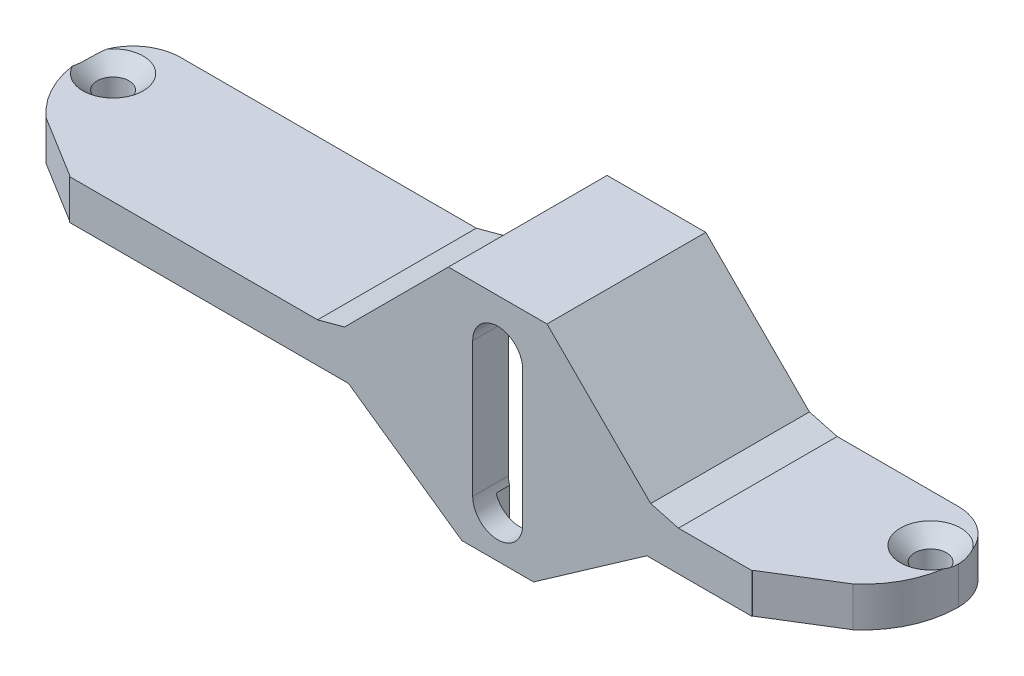
from build123d import *

# Parameters (mm, degrees)
BOSS_EXTRUDE1_DEPTH           = 3
CUT_EXTRUDE1_DEPTH            = 10
CUT_EXTRUDE3_START            = 8
SKETCH8_W                     = 6
SKETCH8_H                     = 3
CUT_EXTRUDE3_DEPTH            = 6
BOSS_EXTRUDE4_START           = 18
BOSS_EXTRUDE4_DEPTH           = 28
BOSS_EXTRUDE5_DEPTH           = 3
CUT_EXTRUDE4_DEPTH            = 3
CUT_EXTRUDE5_DEPTH            = 10
SKETCH18_R                    = 1.5
BOSS_EXTRUDE9_DEPTH           = 2
CHAMFER1_SIZE                 = 15
CHAMFER2_SIZE                 = 15
CHAMFER2_SIZE_2               = 10.503113073
CUT_EXTRUDE6_DEPTH            = 5
BOSS_EXTRUDE8_DEPTH           = 2
CHAMFER3_DEPTH                = 6
CHAMFER3_2_DEPTH              = 5
CSK_FOR_M4_SFHCS1_D           = 4
CSK_FOR_M4_SFHCS1_DEPTH       = 30.798278762
CSK_FOR_M4_SFHCS1_CSINK_D     = 7.6
CSK_FOR_M4_SFHCS1_CSINK_ANGLE = 90
CSK_FOR_M4_SFHCS1_TIP         = 1.201721238
CUT_EXTRUDE7_DEPTH            = 1.5
BOSS_EXTRUDE10_START          = -6
BOSS_EXTRUDE10_DEPTH          = 20
CHAMFER4_SIZE                 = 1.07179677
CHAMFER4_SIZE_2               = 4


with BuildPart() as part:
    # Sketch1 → Boss-Extrude1 (new body)
    with BuildSketch(Plane(origin=(0, 0, 0), x_dir=(1, 0, 0), z_dir=(0, 1, 0))):
        with BuildLine():
            ThreePointArc((-49, -6), (-53.242640687, -4.242640687), (-55, 0))
            ThreePointArc((-55, 0), (-51.485281374, -8.485281374), (-43, -12))
            Line((-43, -12), (43, -12))
            ThreePointArc((43, -12), (51.485281374, -8.485281374), (55, 0))
            ThreePointArc((55, 0), (53.242640687, -4.242640687), (49, -6))
            Line((49, -6), (-49, -6))
        make_face()
        with BuildLine():
            Line((-53, 0), (-55, 0))
            ThreePointArc((-55, 0), (-53.242640687, -4.242640687), (-49, -6))
            Line((-49, -6), (49, -6))
            ThreePointArc((49, -6), (53.242640687, -4.242640687), (55, 0))
            Line((55, 0), (53, 0))
            ThreePointArc((53, 0), (51.5, -1.5), (50, 0))
            Line((50, 0), (-50, 0))
            ThreePointArc((-50, 0), (-51.5, -1.5), (-53, 0))
        make_face()
        with BuildLine():
            Line((49, 6), (-49, 6))
            ThreePointArc((-49, 6), (-53.242640687, 4.242640687), (-55, 0))
            Line((-55, 0), (-53, 0))
            ThreePointArc((-53, 0), (-51.5, 1.5), (-50, 0))
            Line((-50, 0), (50, 0))
            ThreePointArc((50, 0), (51.5, 1.5), (53, 0))
            Line((53, 0), (55, 0))
            ThreePointArc((55, 0), (53.242640687, 4.242640687), (49, 6))
        make_face()
    extrude(amount=BOSS_EXTRUDE1_DEPTH)

    # Sketch2 → Cut-Extrude1 (cut)
    with BuildSketch(Plane(origin=(0, 3, 0), x_dir=(1, 0, 0), z_dir=(0, 1, 0))):
        Polygon((22, -8), (36, 6), (-14, 6), (0, -8), align=None)
    extrude(amount=-CUT_EXTRUDE1_DEPTH, mode=Mode.SUBTRACT)

    # Sketch8 → Cut-Extrude3 (cut)
    with BuildSketch(Plane.XY.offset(CUT_EXTRUDE3_START)):
        with Locations((10.960071178, 1.5)):
            Rectangle(SKETCH8_W, SKETCH8_H)
    extrude(amount=CUT_EXTRUDE3_DEPTH, mode=Mode.SUBTRACT)


with BuildPart() as cut_extrude3_piece_1:
    # of the separate pieces the step leaves, piece 1, a body of its own (cut_extrude3_pieces)
    add(part.part.solids().sort_by_distance((-55, 0, 0))[0])

    # Sketch9 → Boss-Extrude4 (add)
    with BuildSketch(Plane(origin=(0, 0, 0), x_dir=(1, 0, 0), z_dir=(0, 1, 0)).offset(BOSS_EXTRUDE4_START)):
        Polygon((13.960071178, -11.2), (13.960071178, -8), (14.760071178, -8), (14.760071178, -12), (7.160071178, -12), (7.160071178, -8), (7.960071178, -8), (7.960071178, -11.2), align=None)
    extrude(amount=-BOSS_EXTRUDE4_DEPTH)


with BuildPart() as cut_extrude3_piece_2:
    # of the separate pieces the step leaves, piece 2, a body of its own (cut_extrude3_pieces)
    add(part.part.solids().sort_by_distance((13.960071178, 0, 12))[0])


with BuildPart() as cut_extrude3_piece_1_1:
    add(cut_extrude3_piece_1.part)

    # Combine1: union Cut-Extrude3 piece 2
    add(cut_extrude3_piece_2.part)

    # Sketch11 → Boss-Extrude5 (add)
    with BuildSketch(Plane(origin=(0, 3, 0), x_dir=(1, 0, 0), z_dir=(0, 1, 0))):
        Polygon((-14, 6), (-12, 6), (2, -8), (0, -8), align=None)
        Polygon((20, -8), (34, 6), (36, 6), (22, -8), align=None)
    extrude(amount=-BOSS_EXTRUDE5_DEPTH)

    # Sketch13 → Cut-Extrude4 (cut)
    with BuildSketch(Plane(origin=(0, 3, 0), x_dir=(1, 0, 0), z_dir=(0, 1, 0))):
        Polygon((2, -8), (-2, -8), (-2, -4), align=None)
        Polygon((24, -4), (24, -8), (20, -8), align=None)
    extrude(amount=-CUT_EXTRUDE4_DEPTH, mode=Mode.SUBTRACT)

    # Sketch15 → Cut-Extrude5 (cut)
    with BuildSketch(Plane.XY.offset(12)):
        with BuildLine():
            Line((14.110071178, 12.5), (14.110071178, -4.5))
            ThreePointArc((14.110071178, -4.5), (10.960071178, -7.65), (7.810071178, -4.5))
            Line((7.810071178, -4.5), (7.810071178, 12.5))
            ThreePointArc((7.810071178, 12.5), (10.960071178, 15.65), (14.110071178, 12.5))
        make_face()
    extrude(amount=-CUT_EXTRUDE5_DEPTH, mode=Mode.SUBTRACT)

    # Sketch18 → Boss-Extrude9 (add)
    # profile 1 of 2: a face of its own
    with BuildSketch(Plane(origin=(0, 3, 0), x_dir=(1, 0, 0), z_dir=(0, 1, 0))):
        with BuildLine():
            Line((7.160071178, -8), (-2, -8))
            Line((-2, -8), (-2, -4))
            Line((-2, -4), (-12, 6))
            Line((-12, 6), (-49, 6))
            ThreePointArc((-49, 6), (-53.242640687, 4.242640687), (-55, 0))
            ThreePointArc((-55, 0), (-51.485281374, -8.485281374), (-43, -12))
            Line((-43, -12), (7.160071178, -12))
            Line((7.160071178, -12), (7.160071178, -8))
        make_face()
        with Locations(Location((-51.5, 0, 0), (0, 0, 270))):
            Circle(SKETCH18_R, mode=Mode.SUBTRACT)
    # profile 2 of 2: a face of its own
    with BuildSketch(Plane(origin=(0, 3, 0), x_dir=(1, 0, 0), z_dir=(0, 1, 0))):
        with BuildLine():
            Line((24, -4), (24, -8))
            Line((24, -8), (14.760071178, -8))
            Line((14.760071178, -8), (14.760071178, -12))
            Line((14.760071178, -12), (43, -12))
            ThreePointArc((43, -12), (51.485281374, -8.485281374), (55, 0))
            ThreePointArc((55, 0), (53.242640687, 4.242640687), (49, 6))
            Line((49, 6), (34, 6))
            Line((34, 6), (24, -4))
        make_face()
        with Locations(Location((51.5, 0, 0), (0, 0, 270))):
            Circle(SKETCH18_R, mode=Mode.SUBTRACT)
    extrude(amount=BOSS_EXTRUDE9_DEPTH)

    # Chamfer1
    # the kernel refuses this chamfer: 15 mm, written as the material it adds along each edge
    with BuildSketch(Plane(origin=(14.760071178, 5, 8), x_dir=(0, 1, 0), z_dir=(0, 0, 1))) as chamfer1_piece_1_section:
        Polygon((CHAMFER1_SIZE, 0), (0, -CHAMFER1_SIZE), (0, 0), align=None)
    chamfer1_piece_1 = extrude(amount=4, mode=Mode.PRIVATE)
    chamfer1_piece_1 = split(chamfer1_piece_1, bisect_by=Plane(origin=(14.760071178, 18, 8), z_dir=(0, -1, 0)), keep=Keep.TOP, mode=Mode.PRIVATE)
    chamfer1_piece_1 = split(chamfer1_piece_1, bisect_by=Plane(origin=(17.380035589, 5, 10.619964411), z_dir=(-0.7071067811865474, 0, -0.7071067811865477)), keep=Keep.TOP, mode=Mode.PRIVATE)
    add(chamfer1_piece_1)
    with BuildSketch(Plane(origin=(14.760071178, 5, -30.575244819), x_dir=(0, 1, 0), z_dir=(0, 0, 1))) as chamfer1_piece_2_section:
        Polygon((CHAMFER1_SIZE, 0), (0, -CHAMFER1_SIZE), (0, 0), align=None)
    chamfer1_piece_2 = extrude(amount=42.575244819, mode=Mode.PRIVATE)
    chamfer1_piece_2 = split(chamfer1_piece_2, bisect_by=Plane(origin=(14.760071178, 5, 8), z_dir=(0, 0, -1)), keep=Keep.TOP, mode=Mode.PRIVATE)
    chamfer1_piece_2 = split(chamfer1_piece_2, bisect_by=Plane(origin=(36.667657999, 5, -8.667657999), z_dir=(0.7071067811865474, 0, 0.7071067811865477)), keep=Keep.TOP, mode=Mode.PRIVATE)
    chamfer1_piece_2 = split(chamfer1_piece_2, bisect_by=Plane(origin=(24, 5, -30.575244819), z_dir=(1, 0, 0)), keep=Keep.TOP, mode=Mode.PRIVATE)
    add(chamfer1_piece_2)
    with BuildSketch(Plane(origin=(14.760071178, 5, 8), x_dir=(0, 1, 0), z_dir=(0, 0, 1))) as chamfer1_piece_3_section:
        Polygon((CHAMFER1_SIZE, 0), (0, -CHAMFER1_SIZE), (0, 0), align=None)
    chamfer1_piece_3 = extrude(amount=4, mode=Mode.PRIVATE)
    chamfer1_piece_3 = split(chamfer1_piece_3, bisect_by=Plane(origin=(14.760071178, 18, 8), z_dir=(0, -1, 0)), keep=Keep.TOP, mode=Mode.PRIVATE)
    chamfer1_piece_3 = split(chamfer1_piece_3, bisect_by=Plane(origin=(17.380035589, 5, 10.619964411), z_dir=(0.7071067811865474, 0, 0.7071067811865477)), keep=Keep.TOP, mode=Mode.PRIVATE)
    chamfer1_piece_3 = split(chamfer1_piece_3, bisect_by=Plane(origin=(24, 5, 8), z_dir=(-1, 0, 0)), keep=Keep.TOP, mode=Mode.PRIVATE)
    add(chamfer1_piece_3)
    with BuildSketch(Plane(origin=(14.760071178, 5, 8), x_dir=(0, 1, 0), z_dir=(0, 0, 1))) as chamfer1_piece_4_section:
        Polygon((CHAMFER1_SIZE, 0), (0, -CHAMFER1_SIZE), (0, 0), align=None)
    chamfer1_piece_4 = extrude(amount=4, mode=Mode.PRIVATE)
    chamfer1_piece_4 = split(chamfer1_piece_4, bisect_by=Plane(origin=(24, 5, 8), z_dir=(1, 0, 0)), keep=Keep.TOP, mode=Mode.PRIVATE)
    add(chamfer1_piece_4)
    with BuildSketch(Plane(origin=(7.160071178, 5, 12), x_dir=(0, 1, 0), z_dir=(0, 0, -1))) as chamfer1_piece_5_section:
        Polygon((CHAMFER1_SIZE, 0), (0, -CHAMFER1_SIZE), (0, 0), align=None)
    chamfer1_piece_5 = extrude(amount=4, mode=Mode.PRIVATE)
    chamfer1_piece_5 = split(chamfer1_piece_5, bisect_by=Plane(origin=(6.580035589, 5, 12.580035589), z_dir=(-0.7071067811865489, 0, 0.7071067811865461)), keep=Keep.TOP, mode=Mode.PRIVATE)
    chamfer1_piece_5 = split(chamfer1_piece_5, bisect_by=Plane(origin=(-2, 5, 12), z_dir=(1, 0, 0)), keep=Keep.TOP, mode=Mode.PRIVATE)
    chamfer1_piece_5 = split(chamfer1_piece_5, bisect_by=Plane(origin=(7.160071178, 18, 12), z_dir=(0, -1, 0)), keep=Keep.TOP, mode=Mode.PRIVATE)
    add(chamfer1_piece_5)
    with BuildSketch(Plane(origin=(7.160071178, 5, 12), x_dir=(0, 1, 0), z_dir=(0, 0, -1))) as chamfer1_piece_6_section:
        Polygon((CHAMFER1_SIZE, 0), (0, -CHAMFER1_SIZE), (0, 0), align=None)
    chamfer1_piece_6 = extrude(amount=4, mode=Mode.PRIVATE)
    chamfer1_piece_6 = split(chamfer1_piece_6, bisect_by=Plane(origin=(-2, 5, 12), z_dir=(-1, 0, 0)), keep=Keep.TOP, mode=Mode.PRIVATE)
    add(chamfer1_piece_6)
    with BuildSketch(Plane(origin=(7.160071178, 5, 12), x_dir=(0, 1, 0), z_dir=(0, 0, -1))) as chamfer1_piece_7_section:
        Polygon((CHAMFER1_SIZE, 0), (0, -CHAMFER1_SIZE), (0, 0), align=None)
    chamfer1_piece_7 = extrude(amount=4, mode=Mode.PRIVATE)
    chamfer1_piece_7 = split(chamfer1_piece_7, bisect_by=Plane(origin=(6.580035589, 5, 12.580035589), z_dir=(0.7071067811865489, 0, -0.7071067811865461)), keep=Keep.TOP, mode=Mode.PRIVATE)
    chamfer1_piece_7 = split(chamfer1_piece_7, bisect_by=Plane(origin=(7.160071178, 18, 12), z_dir=(0, -1, 0)), keep=Keep.TOP, mode=Mode.PRIVATE)
    add(chamfer1_piece_7)
    with BuildSketch(Plane(origin=(7.160071178, 5, 12), x_dir=(0, 1, 0), z_dir=(0, 0, -1))) as chamfer1_piece_8_section:
        Polygon((CHAMFER1_SIZE, 0), (0, -CHAMFER1_SIZE), (0, 0), align=None)
    chamfer1_piece_8 = extrude(amount=42.575244819, mode=Mode.PRIVATE)
    chamfer1_piece_8 = split(chamfer1_piece_8, bisect_by=Plane(origin=(6.580035589, 5, 12.580035589), z_dir=(-0.7071067811865489, 0, 0.7071067811865461)), keep=Keep.TOP, mode=Mode.PRIVATE)
    chamfer1_piece_8 = split(chamfer1_piece_8, bisect_by=Plane(origin=(-2, 5, 12), z_dir=(-1, 0, 0)), keep=Keep.TOP, mode=Mode.PRIVATE)
    chamfer1_piece_8 = split(chamfer1_piece_8, bisect_by=Plane(origin=(7.160071178, 5, 8), z_dir=(0, 0, -1)), keep=Keep.TOP, mode=Mode.PRIVATE)
    add(chamfer1_piece_8)

    # Chamfer2
    # the kernel refuses this chamfer: 15, 10.503113073 mm, written as the material it adds along each edge
    with BuildSketch(Plane(origin=(7.160071178, 0, 12), x_dir=(-1, 0, 0), z_dir=(0, 0, -1))) as chamfer2_piece_1_section:
        Polygon((CHAMFER2_SIZE, 0), (0, -CHAMFER2_SIZE_2), (0, 0), align=None)
    chamfer2_piece_1 = extrude(amount=4, mode=Mode.PRIVATE)
    chamfer2_piece_1 = split(chamfer2_piece_1, bisect_by=Plane(origin=(-2, 0, 12), z_dir=(-1, 0, 0)), keep=Keep.TOP, mode=Mode.PRIVATE)
    add(chamfer2_piece_1)
    with BuildSketch(Plane(origin=(7.160071178, 0, 12), x_dir=(-1, 0, 0), z_dir=(0, 0, -1))) as chamfer2_piece_2_section:
        Polygon((CHAMFER2_SIZE, 0), (0, -CHAMFER2_SIZE_2), (0, 0), align=None)
    chamfer2_piece_2 = extrude(amount=4, mode=Mode.PRIVATE)
    chamfer2_piece_2 = split(chamfer2_piece_2, bisect_by=Plane(origin=(6.580035589, 0, 12.580035589), z_dir=(-0.7071067811865476, 0, 0.7071067811865476)), keep=Keep.TOP, mode=Mode.PRIVATE)
    chamfer2_piece_2 = split(chamfer2_piece_2, bisect_by=Plane(origin=(-2, 0, 12), z_dir=(1, 0, 0)), keep=Keep.TOP, mode=Mode.PRIVATE)
    add(chamfer2_piece_2)
    with BuildSketch(Plane(origin=(7.160071178, 0, 12), x_dir=(-1, 0, 0), z_dir=(0, 0, -1))) as chamfer2_piece_3_section:
        Polygon((CHAMFER2_SIZE, 0), (0, -CHAMFER2_SIZE_2), (0, 0), align=None)
    chamfer2_piece_3 = extrude(amount=42.738283454, mode=Mode.PRIVATE)
    chamfer2_piece_3 = split(chamfer2_piece_3, bisect_by=Plane(origin=(6.580035589, 0, 12.580035589), z_dir=(-0.7071067811865476, 0, 0.7071067811865476)), keep=Keep.TOP, mode=Mode.PRIVATE)
    chamfer2_piece_3 = split(chamfer2_piece_3, bisect_by=Plane(origin=(7.160071178, 0, 8), z_dir=(0, 0, -1)), keep=Keep.TOP, mode=Mode.PRIVATE)
    chamfer2_piece_3 = split(chamfer2_piece_3, bisect_by=Plane(origin=(-2, 0, 12), z_dir=(-1, 0, 0)), keep=Keep.TOP, mode=Mode.PRIVATE)
    add(chamfer2_piece_3)
    with BuildSketch(Plane(origin=(7.160071178, 0, 12), x_dir=(-1, 0, 0), z_dir=(0, 0, -1))) as chamfer2_piece_4_section:
        Polygon((CHAMFER2_SIZE, 0), (0, -CHAMFER2_SIZE_2), (0, 0), align=None)
    chamfer2_piece_4 = extrude(amount=4, mode=Mode.PRIVATE)
    chamfer2_piece_4 = split(chamfer2_piece_4, bisect_by=Plane(origin=(6.580035589, 0, 12.580035589), z_dir=(0.7071067811865476, 0, -0.7071067811865476)), keep=Keep.TOP, mode=Mode.PRIVATE)
    chamfer2_piece_4 = split(chamfer2_piece_4, bisect_by=Plane(origin=(7.160071178, -10, 12), z_dir=(0, 1, 0)), keep=Keep.TOP, mode=Mode.PRIVATE)
    add(chamfer2_piece_4)
    with BuildSketch(Plane(origin=(14.760071178, 0, 12), x_dir=(0, -1, 0), z_dir=(0, 0, -1))) as chamfer2_piece_5_section:
        Polygon((CHAMFER2_SIZE_2, 0), (0, -CHAMFER2_SIZE), (0, 0), align=None)
    chamfer2_piece_5 = extrude(amount=4, mode=Mode.PRIVATE)
    chamfer2_piece_5 = split(chamfer2_piece_5, bisect_by=Plane(origin=(15.380035589, 0, 12.619964411), z_dir=(0.7071067811865476, 0, 0.7071067811865476)), keep=Keep.TOP, mode=Mode.PRIVATE)
    chamfer2_piece_5 = split(chamfer2_piece_5, bisect_by=Plane(origin=(24, 0, 12), z_dir=(-1, 0, 0)), keep=Keep.TOP, mode=Mode.PRIVATE)
    add(chamfer2_piece_5)
    with BuildSketch(Plane(origin=(14.760071178, 0, 12), x_dir=(0, -1, 0), z_dir=(0, 0, -1))) as chamfer2_piece_6_section:
        Polygon((CHAMFER2_SIZE_2, 0), (0, -CHAMFER2_SIZE), (0, 0), align=None)
    chamfer2_piece_6 = extrude(amount=4, mode=Mode.PRIVATE)
    chamfer2_piece_6 = split(chamfer2_piece_6, bisect_by=Plane(origin=(24, 0, 12), z_dir=(1, 0, 0)), keep=Keep.TOP, mode=Mode.PRIVATE)
    add(chamfer2_piece_6)
    with BuildSketch(Plane(origin=(14.760071178, 0, 12), x_dir=(0, -1, 0), z_dir=(0, 0, -1))) as chamfer2_piece_7_section:
        Polygon((CHAMFER2_SIZE_2, 0), (0, -CHAMFER2_SIZE), (0, 0), align=None)
    chamfer2_piece_7 = extrude(amount=4, mode=Mode.PRIVATE)
    chamfer2_piece_7 = split(chamfer2_piece_7, bisect_by=Plane(origin=(14.760071178, -10, 12), z_dir=(0, 1, 0)), keep=Keep.TOP, mode=Mode.PRIVATE)
    chamfer2_piece_7 = split(chamfer2_piece_7, bisect_by=Plane(origin=(15.380035589, 0, 12.619964411), z_dir=(-0.7071067811865476, 0, -0.7071067811865476)), keep=Keep.TOP, mode=Mode.PRIVATE)
    add(chamfer2_piece_7)
    with BuildSketch(Plane(origin=(14.760071178, 0, 12), x_dir=(0, -1, 0), z_dir=(0, 0, -1))) as chamfer2_piece_8_section:
        Polygon((CHAMFER2_SIZE_2, 0), (0, -CHAMFER2_SIZE), (0, 0), align=None)
    chamfer2_piece_8 = extrude(amount=42.738283454, mode=Mode.PRIVATE)
    chamfer2_piece_8 = split(chamfer2_piece_8, bisect_by=Plane(origin=(14.760071178, 0, 8), z_dir=(0, 0, -1)), keep=Keep.TOP, mode=Mode.PRIVATE)
    chamfer2_piece_8 = split(chamfer2_piece_8, bisect_by=Plane(origin=(15.380035589, 0, 12.619964411), z_dir=(0.7071067811865476, 0, 0.7071067811865476)), keep=Keep.TOP, mode=Mode.PRIVATE)
    chamfer2_piece_8 = split(chamfer2_piece_8, bisect_by=Plane(origin=(24, 0, 12), z_dir=(1, 0, 0)), keep=Keep.TOP, mode=Mode.PRIVATE)
    add(chamfer2_piece_8)

    # Sketch16 → Cut-Extrude6 (cut)
    with BuildSketch(Plane(origin=(0, 0, 0), x_dir=(1, 0, 0), z_dir=(0, 1, 0))):
        Polygon((-7.839928822, 1.839928822), (-2, -4), (-2, -8), (-7.839928822, -8), align=None)
        Polygon((24, -8), (24, -4), (29.760071178, 1.760071178), (29.760071178, -8), align=None)
    extrude(amount=-CUT_EXTRUDE6_DEPTH, mode=Mode.SUBTRACT)

    # Sketch17 → Boss-Extrude8 (add)
    with BuildSketch(Plane.XY.offset(12)):
        Polygon((-7.839928822, 0), (6.441551245, -10), (15.47859111, -10), (29.760071178, 0), (43, 0), (43, 5), (29.760071178, 5), (16.760071178, 18), (5.160071178, 18), (-7.839928822, 5), (-43, 5), (-43, 0), align=None)
        with BuildLine():
            Line((7.810071178, -4.5), (7.810071178, 12.5))
            ThreePointArc((7.810071178, 12.5), (10.960071178, 15.65), (14.110071178, 12.5))
            Line((14.110071178, 12.5), (14.110071178, -4.5))
            ThreePointArc((14.110071178, -4.5), (10.960071178, -7.65), (7.810071178, -4.5))
        make_face(mode=Mode.SUBTRACT)
    extrude(amount=BOSS_EXTRUDE8_DEPTH)

    # Chamfer3: read off the stored shape, not the designer's step
    # Chamfer3 outline → Chamfer3 (cut)
    with BuildSketch(Plane(origin=(0, 0, 0), x_dir=(1, 0, 0), z_dir=(0, 1, 0))):
        with BuildLine():
            ThreePointArc((47.608318931, -11.079864468), (49.300429772, -10.212961602), (50.834384089, -9.08968789))
            Line((50.834384089, -9.08968789), (47.608318931, -11.079864468))
        make_face()
        with BuildLine():
            ThreePointArc((-50.834384089, -9.08968789), (-49.300429772, -10.212961602), (-47.608318931, -11.079864468))
            Line((-47.608318931, -11.079864468), (-50.834384089, -9.08968789))
        make_face()
    extrude(amount=CHAMFER3_DEPTH, mode=Mode.SUBTRACT)

    # Chamfer3 2 outline → Chamfer3 2 (add)
    with BuildSketch(Plane(origin=(0, 0, 0), x_dir=(1, 0, 0), z_dir=(0, 1, 0))):
        with BuildLine():
            Line((43, -13.922760673), (47.608318931, -11.079864468))
            ThreePointArc((47.608318931, -11.079864468), (45.349641077, -11.767717995), (43, -12))
            Line((43, -12), (43, -13.922760673))
        make_face()
        with BuildLine():
            Line((-47.608318931, -11.079864468), (-43, -13.922760673))
            Line((-43, -13.922760673), (-43, -12))
            ThreePointArc((-43, -12), (-45.349641077, -11.767717995), (-47.608318931, -11.079864468))
        make_face()
    extrude(amount=CHAMFER3_2_DEPTH)

    # CSK for M4 SFHCS1
    with Locations(Plane(origin=(0, 5, 0), x_dir=(1, 0, 0), z_dir=(0, 1, 0))):
        with Locations((-51.5, 0), (51.5, 0)):
            CounterSinkHole(CSK_FOR_M4_SFHCS1_D / 2, CSK_FOR_M4_SFHCS1_CSINK_D / 2, depth=CSK_FOR_M4_SFHCS1_DEPTH, counter_sink_angle=CSK_FOR_M4_SFHCS1_CSINK_ANGLE)
            with Locations((0, 0, -(CSK_FOR_M4_SFHCS1_DEPTH + CSK_FOR_M4_SFHCS1_TIP / 2))):  # 118° drill point
                Cone(0, CSK_FOR_M4_SFHCS1_D / 2, CSK_FOR_M4_SFHCS1_TIP, mode=Mode.SUBTRACT)

    # Sketch21 → Cut-Extrude7 (cut)
    with BuildSketch(Plane(origin=(0, 0, 8), x_dir=(-1, 0, 0), z_dir=(0, 0, -1))):
        Polygon((-13.960071178, -10), (-13.960071178, 18), (-16.760071178, 18), (-16.760071178, -9.102697997), (-15.47859111, -10), align=None)
        Polygon((-7.960071178, -10), (-7.960071178, 18), (-5.160071178, 18), (-5.160071178, -9.102697997), (-6.441551245, -10), align=None)
    extrude(amount=-CUT_EXTRUDE7_DEPTH, mode=Mode.SUBTRACT)

    # Sketch22 → Boss-Extrude10 (add)
    with BuildSketch(Plane.XY.offset(BOSS_EXTRUDE10_START)):
        Polygon((34, 3), (28.931644053, 3), (15.931644053, 16), (5.988498302, 16), (-7.011501698, 3), (-12, 3), (-12, 6), (-8.254142385, 6), (4.745857615, 19), (17.17428474, 19), (30.17428474, 6), (34, 6), align=None)
    extrude(amount=BOSS_EXTRUDE10_DEPTH)

    # Chamfer4
    # the kernel refuses this chamfer: 4, 1.07179677 mm, written as the material it takes off along each edge
    with BuildSketch(Plane(origin=(-12, 6, -16.386886281), x_dir=(0, -1, 0), z_dir=(0, 0, 1))) as chamfer4_piece_1_section:
        Polygon((CHAMFER4_SIZE, 0), (0, CHAMFER4_SIZE_2), (0, 0), align=None)
    chamfer4_piece_1 = extrude(amount=40.773772562, mode=Mode.PRIVATE)
    chamfer4_piece_1 = split(chamfer4_piece_1, bisect_by=Plane(origin=(-12, 5, -16.386886281), z_dir=(0, 1, 0)), keep=Keep.TOP, mode=Mode.PRIVATE)
    chamfer4_piece_1 = split(chamfer4_piece_1, bisect_by=Plane(origin=(-10.127071192, 4.127071192, -16.386886281), z_dir=(-0.707106781186548, 0.7071067811865472, 0)), keep=Keep.TOP, mode=Mode.PRIVATE)
    add(chamfer4_piece_1, mode=Mode.SUBTRACT)
    with BuildSketch(Plane(origin=(34, 6, -16.386886281), x_dir=(-1, 0, 0), z_dir=(0, 0, 1))) as chamfer4_piece_2_section:
        Polygon((CHAMFER4_SIZE_2, 0), (0, CHAMFER4_SIZE), (0, 0), align=None)
    chamfer4_piece_2 = extrude(amount=40.773772562, mode=Mode.PRIVATE)
    chamfer4_piece_2 = split(chamfer4_piece_2, bisect_by=Plane(origin=(34, 5, -16.386886281), z_dir=(0, 1, 0)), keep=Keep.TOP, mode=Mode.PRIVATE)
    chamfer4_piece_2 = split(chamfer4_piece_2, bisect_by=Plane(origin=(32.08714237, 4.08714237, -16.386886281), z_dir=(0.7071067811865475, 0.7071067811865476, 0)), keep=Keep.TOP, mode=Mode.PRIVATE)
    add(chamfer4_piece_2, mode=Mode.SUBTRACT)


solid = cut_extrude3_piece_1_1.part
